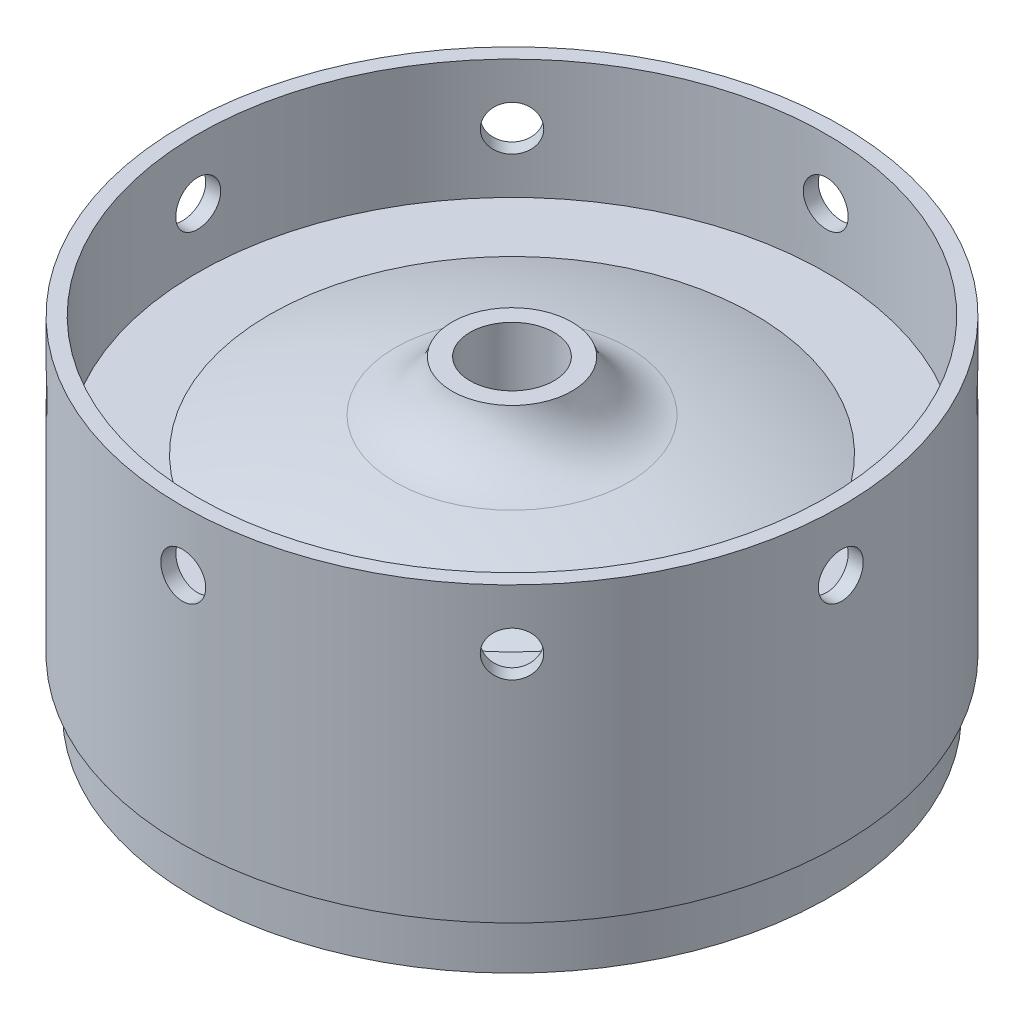
from build123d import *

# Parameters (mm, degrees)
CIRPATTERN1_COUNT = 8


with BuildPart() as part:
    # Sketch1 → Revolve2 (revolve)
    with BuildSketch(Plane.XY):
        with BuildLine():
            Line((-69.85, 73.025), (-69.85, 10.954807942))
            Line((-69.85, 10.954807942), (-67.3735, 9.525))
            Line((-67.3735, 9.525), (-67.3735, 0))
            Line((-67.3735, 0), (-65.786, 0))
            Line((-65.786, 0), (-65.786, 9.525))
            Line((-65.786, 9.525), (-63.391760989, 23.103404173))
            ThreePointArc((-63.391760989, 23.103404173), (-60.094186985, 33.816180435), (-51.343091672, 40.820172182))
            ThreePointArc((-51.343091672, 40.820172182), (-30.496427365, 47.22790002), (-8.90651, 50.313002445))
            Line((-8.90651, 50.313002445), (-8.90651, 65.553002445))
            Line((-8.90651, 65.553002445), (-12.7, 65.553002445))
            ThreePointArc((-12.7, 65.553002445), (-17.186678975, 58.473350869), (-24.738335993, 54.836837298))
            ThreePointArc((-24.738335993, 54.836837298), (-38.21123602, 51.859981806), (-51.343091672, 47.625))
            Line((-51.343091672, 47.625), (-66.675, 47.625))
            Line((-66.675, 47.625), (-66.675, 73.025))
            Line((-66.675, 73.025), (-69.85, 73.025))
        make_face()
    revolve(axis=Axis((0, 127.060987048, 0), (0, -1, 0)))

    # Sketch5 → 3/8 (0.375) Diameter Hole1 (revolve, cut)
    with BuildSketch(Plane(origin=(0, 60.325, 69.85), x_dir=(0, -1, 0), z_dir=(1, 0, 0))):
        Polygon((0, 0), (0, 14.545598698), (4.7625, 11.684), (4.7625, 0), align=None)
    f_3_8_0_375_diameter_hole1 = revolve(axis=Axis((0, 60.325, 76.2), (0, 0, -1)), mode=Mode.SUBTRACT)

    # CirPattern1: 3/8 (0.375) Diameter Hole1 ×8 about axis
    cirpattern1_axis = Axis((0, 127.060987048, 0), (0, -1, 0))
    for i in range(1, CIRPATTERN1_COUNT):
        add(f_3_8_0_375_diameter_hole1.rotate(cirpattern1_axis, i * 360 / CIRPATTERN1_COUNT), mode=Mode.SUBTRACT)


solid = part.part
